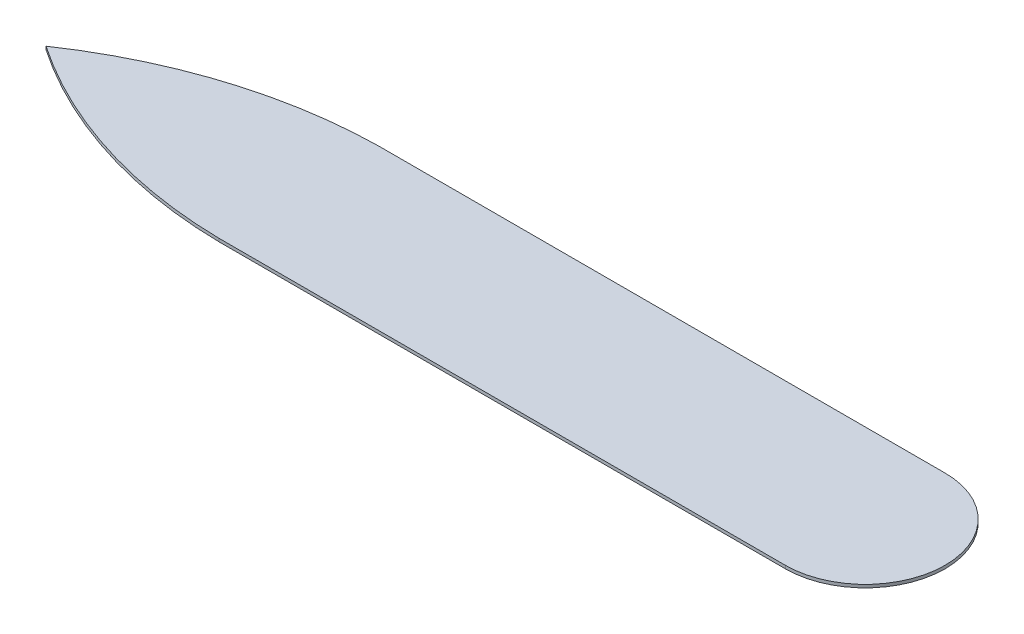
from build123d import *

# Parameters (mm, degrees)
BOSS_EXTRUDE1_DEPTH = 3


with BuildPart() as part:
    # Sketch1 → Boss-Extrude1 (new body)
    with BuildSketch(Plane(origin=(0, 0, 0), x_dir=(1, 0, 0), z_dir=(0, 1, 0))):
        with BuildLine():
            Line((247.069884649, 0), (800, 0))
            ThreePointArc((800, 0), (878, 78), (800, 156))
            Line((800, 156), (247.069884649, 156))
            ThreePointArc((247.069884649, 156), (117.814256938, 135.120629211), (0, 78))
            ThreePointArc((0, 78), (117.814256938, 20.879370789), (247.069884649, 0))
        make_face()
    extrude(amount=BOSS_EXTRUDE1_DEPTH)


solid = part.part
